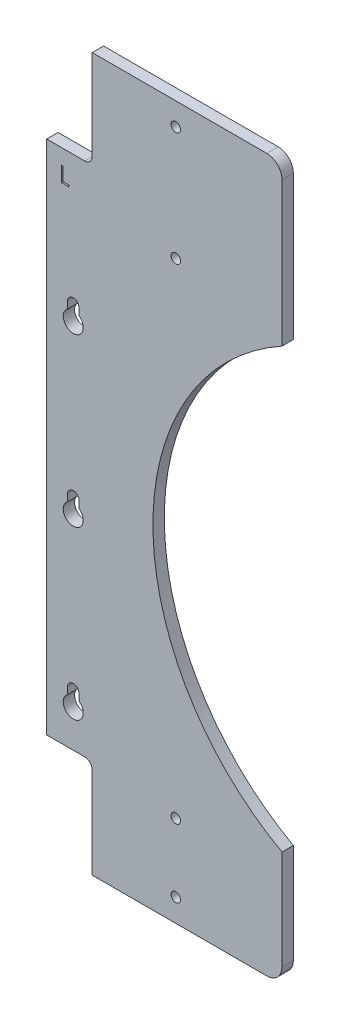
from build123d import *

# Parameters (mm, degrees)
BOSS_EXTRUDE1_DEPTH            = 9.525
V_0_377_DIAMETER_SLOT2_DEPTH   = 9.525
CUT_EXTRUDE1_REACH             = 358.93
SKETCH6_W                      = 152.4
SKETCH6_H                      = 622.3
FILLET1_R                      = 12.7
SKETCH7_R                      = 8.382
CUT_EXTRUDE2_DEPTH             = 357.929879318
SKETCH12_W                     = 38.1
SKETCH12_H                     = 107.95
SKETCH12_H_2                   = 82.55
CUT_EXTRUDE3_DEPTH             = 357.929879318
FILLET2_R                      = 6.35
F_5_16_0_3125_DIAMETER_HOLE1_D = 7.9375
SKETCH16_W                     = 158.75
SKETCH16_H                     = 26.277954941
CUT_EXTRUDE4_DEPTH             = 357.929879318
F_5_16_0_3125_DIAMETER_HOLE2_D = 7.9375
FILLET3_R                      = 12.7
CUT_EXTRUDE5_DEPTH             = 1.27


# Read off the part's stored shape, not the designer's step: V (0.377) Diameter Slot2
with BuildPart() as part:
    # Sketch1 → Boss-Extrude1 (new body)
    with BuildSketch(Plane.XY):
        with BuildLine():
            Line((-174.625, 151.522045059), (-174.625, 311.15))
            Line((-174.625, 311.15), (174.625, 311.15))
            Line((174.625, 311.15), (174.625, 151.522045059))
            ThreePointArc((174.625, 151.522045059), (66.675, -31.75), (174.625, -215.022045059))
            Line((174.625, -215.022045059), (174.625, -311.15))
            Line((174.625, -311.15), (-174.625, -311.15))
            Line((-174.625, -311.15), (-174.625, -215.022045059))
            ThreePointArc((-174.625, -215.022045059), (-66.675, -31.75), (-174.625, 151.522045059))
        make_face()
    extrude(amount=BOSS_EXTRUDE1_DEPTH)

    # V (0.377) Diameter Slot2 outline → V (0.377) Diameter Slot2 (cut)
    with BuildSketch(Plane.XY):
        with BuildLine():
            Line((4.7879, -57.8866), (4.7879, -45.2374))
            ThreePointArc((4.7879, -45.2374), (0, -40.4495), (-4.7879, -45.2374))
            Line((-4.7879, -45.2374), (-4.7879, -57.8866))
            ThreePointArc((-4.7879, -57.8866), (0, -62.6745), (4.7879, -57.8866))
        make_face()
        with BuildLine():
            ThreePointArc((4.7879, 94.4626), (0, 99.2505), (-4.7879, 94.4626))
            Line((-4.7879, 94.4626), (-4.7879, 81.8134))
            ThreePointArc((-4.7879, 81.8134), (0, 77.0255), (4.7879, 81.8134))
            Line((4.7879, 81.8134), (4.7879, 94.4626))
        make_face()
        with BuildLine():
            ThreePointArc((4.7879, -184.9374), (0, -180.1495), (-4.7879, -184.9374))
            Line((-4.7879, -184.9374), (-4.7879, -197.5866))
            ThreePointArc((-4.7879, -197.5866), (0, -202.3745), (4.7879, -197.5866))
            Line((4.7879, -197.5866), (4.7879, -184.9374))
        make_face()
    extrude(amount=V_0_377_DIAMETER_SLOT2_DEPTH, mode=Mode.SUBTRACT)

    # Sketch6 → Cut-Extrude1 (cut, up to next)
    with BuildSketch(Plane.XY.offset(9.525), mode=Mode.PRIVATE) as cut_extrude1_sk1:
        with Locations((-98.425, 0)):
            Rectangle(SKETCH6_W, SKETCH6_H)
    cut_extrude1_tool1 = extrude(cut_extrude1_sk1.sketch, amount=-CUT_EXTRUDE1_REACH, mode=Mode.PRIVATE) & part.part
    add(cut_extrude1_tool1.solids().sort_by_distance((-98.425, 0, 9.525))[0], mode=Mode.SUBTRACT)

    # Fillet1
    fillet1_edges = [part.edges().sort_by_distance(p)[0] for p in [
        (174.625, -311.15, 4.7625),
    ]]
    fillet(fillet1_edges, radius=FILLET1_R)

    # Sketch7 → Cut-Extrude2 (cut, through all)
    with BuildSketch(Plane.XY.offset(9.525)):
        with Locations((0, -197.5866)):
            Circle(SKETCH7_R)
        with Locations((0, 81.8134)):
            Circle(SKETCH7_R)
        with Locations((0, -57.8866)):
            Circle(SKETCH7_R)
    extrude(amount=-CUT_EXTRUDE2_DEPTH, mode=Mode.SUBTRACT)

    # Sketch12 → Cut-Extrude3 (cut, through all)
    with BuildSketch(Plane.XY.offset(9.525)):
        with Locations((-3.175, 257.175)):
            Rectangle(SKETCH12_W, SKETCH12_H)
        with Locations((-3.175, -269.875)):
            Rectangle(SKETCH12_W, SKETCH12_H_2)
    extrude(amount=-CUT_EXTRUDE3_DEPTH, mode=Mode.SUBTRACT)

    # Fillet2
    fillet2_edges = [part.edges().sort_by_distance(p)[0] for p in [
        (15.875, 203.2, 4.7625),
        (15.875, -228.6, 4.7625),
    ]]
    fillet(fillet2_edges, radius=FILLET2_R)

    # 5/16 (0.3125) Diameter Hole1 (through all)
    with Locations(Plane.XY.offset(9.525)):
        with Locations((85.7885, 170.688), (85.7885, 265.938)):
            Hole(F_5_16_0_3125_DIAMETER_HOLE1_D / 2)

    # Sketch16 → Cut-Extrude4 (cut, through all)
    with BuildSketch(Plane.XY.offset(9.525)):
        with Locations((95.25, 298.011022529)):
            Rectangle(SKETCH16_W, SKETCH16_H)
    extrude(amount=-CUT_EXTRUDE4_DEPTH, mode=Mode.SUBTRACT)

    # 5/16 (0.3125) Diameter Hole2 (through all)
    with Locations(Plane.XY.offset(9.525)):
        with Locations((85.7885, -234.95), (85.7885, -292.1)):
            Hole(F_5_16_0_3125_DIAMETER_HOLE2_D / 2)

    # Fillet3
    fillet3_edges = [part.edges().sort_by_distance(p)[0] for p in [
        (174.625, 284.872045059, 4.7625),
    ]]
    fillet(fillet3_edges, radius=FILLET3_R)

    # Sketch22 → Cut-Extrude5 (cut)
    with BuildSketch(Plane(origin=(0, 0, 9.525), x_dir=(-1, 0, 0), z_dir=(0, 0, -1))):
        Polygon((9.687820513, 190.5), (8.548076923, 190.5), (8.548076923, 179.102564103), (3.663461538, 179.102564103), (3.663461538, 177.8), (9.687820513, 177.8), align=None)
    extrude(amount=CUT_EXTRUDE5_DEPTH, mode=Mode.SUBTRACT)


solid = part.part
